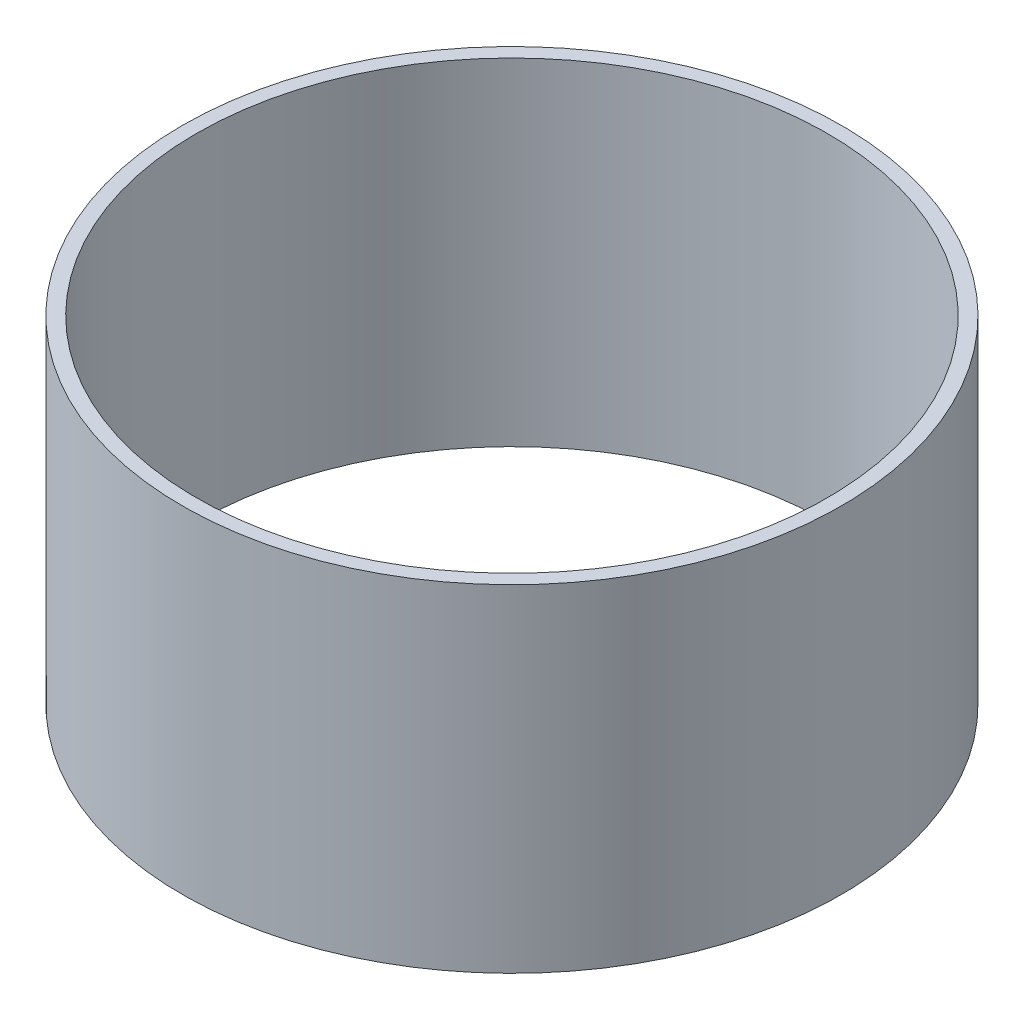
from build123d import *

# Parameters (mm, degrees)
SKETCH1_R           = 298.45
SKETCH1_R_2         = 285.75
BOSS_EXTRUDE1_DEPTH = 304.8


with BuildPart() as part:
    # Sketch1 → Boss-Extrude1 (new body)
    with BuildSketch(Plane(origin=(0, -229.187314536, 0), x_dir=(1, 0, 0), z_dir=(0, 1, 0))):
        Circle(SKETCH1_R)
        Circle(SKETCH1_R_2, mode=Mode.SUBTRACT)
    extrude(amount=-BOSS_EXTRUDE1_DEPTH)


solid = part.part
